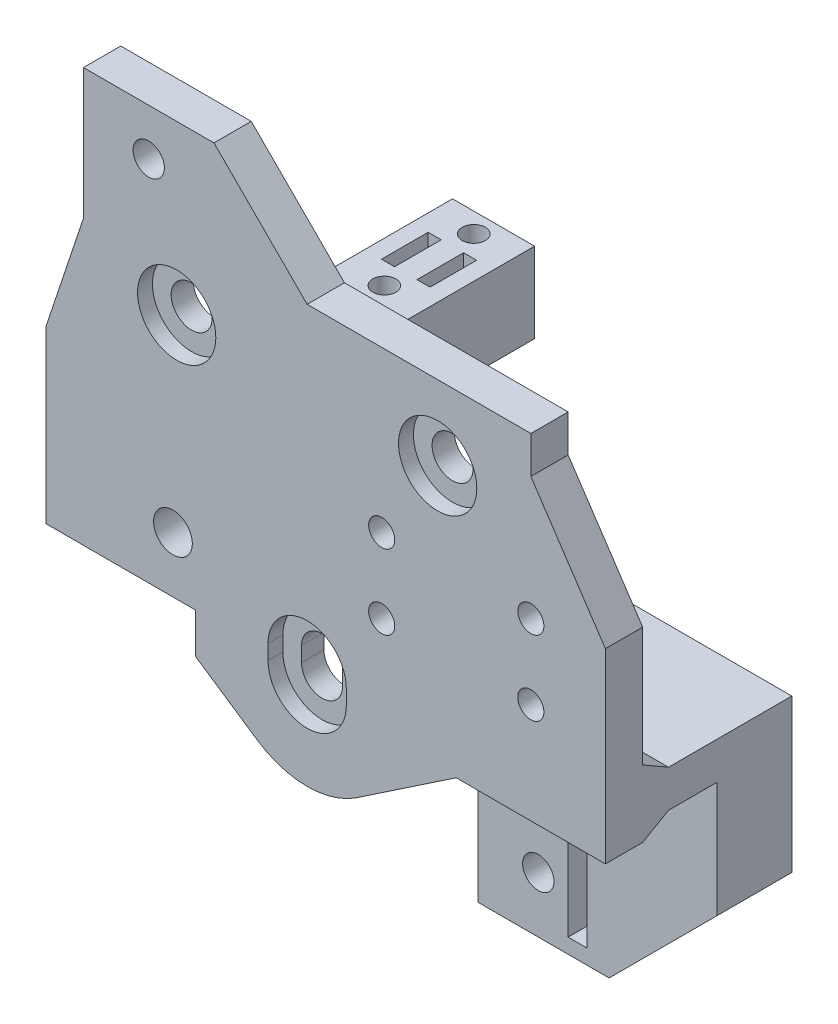
from build123d import *

# Parameters (mm, degrees)
SKETCH_1_R          = 2.75
SKETCH_1_R_2        = 2.1
EXTRUDE_1_DEPTH     = 5
EXTRUDE_START       = 20
SKETCH_2_W          = 11
SKETCH_2_H          = 10.75
EXTRUDE_2_DEPTH     = 20
CHAMFER_1_SIZE      = 2
CHAMFER_1_SIZE2     = 3.464101615
CUT_EXTRUDE_START   = -2
SKETCH_8_R          = 5.25
SKETCH_8_R_2        = 2.75
CUT_EXTRUDE_3_DEPTH = 2
CUT_EXTRUDE_4_REACH = 73.666
SKETCH_9_W          = 1.75
SKETCH_9_H          = 6.25
SKETCH_10_R         = 1.55
CUT_EXTRUDE_5_DEPTH = 8
FILLET_1_R          = 1
CHAMFER_2_SIZE      = 3
SKETCH_11_R         = 1.6
CUT_EXTRUDE_6_DEPTH = 6
EXTRUDE_3_DEPTH     = 3
CHAMFER_3_SIZE      = 2
CHAMFER_4_SIZE      = 0.5
CHAMFER_5_SIZE      = 0.5
EXTRUDE_START_2     = -10
SKETCH_14_W         = 2.5
SKETCH_14_H         = 11
SKETCH_14_R         = 2.1
EXTRUDE_4_DEPTH     = 3
CHAMFER_6_SIZE      = 15
SKETCH_16_R         = 2.6
CUT_EXTRUDE_8_DEPTH = 8.4641
SKETCH_17_R         = 1.75
CUT_EXTRUDE_9_DEPTH = 68.455540914
CHAMFER_7_SIZE      = 2
SKETCH_18_W         = 7
SKETCH_18_H         = 15
EXTRUDE_5_DEPTH     = 2
CHAMFER_9_SIZE      = 2.5
CHAMFER_10_SIZE     = 15


# Some blends are built 0.0001 mm under size
with BuildPart() as part:
    # Эскиз1 → Бобышка-Вытянуть1 (new body)
    with BuildSketch(Plane.XY):
        with BuildLine():
            ThreePointArc((-6.702307645, -31.453847107), (0, -33.5), (6.702307645, -31.453847107))
            Line((6.702307645, -31.453847107), (20, -22.5))
            Line((20, -22.5), (40, -22.5))
            Line((40, -22.5), (40, 2.5))
            Line((40, 2.5), (30, 17.5))
            Line((30, 17.5), (30, 22.5))
            Line((30, 22.5), (0, 22.5))
            Line((0, 22.5), (-12.5, 35))
            Line((-12.5, 35), (-30, 35))
            Line((-30, 35), (-30, 17.5))
            Line((-30, 17.5), (-35, 2.5))
            Line((-35, 2.5), (-35, -20.5))
            Line((-35, -20.5), (-15, -20.5))
            Line((-15, -20.5), (-15, -25.86669208))
            Line((-15, -25.86669208), (-6.702307645, -31.453847107))
        make_face()
        with BuildLine():
            Line((-2.75, -21.5), (-2.75, -19.5))
            ThreePointArc((-2.75, -19.5), (0, -16.75), (2.75, -19.5))
            Line((2.75, -19.5), (2.75, -21.5))
            ThreePointArc((2.75, -21.5), (0, -24.25), (-2.75, -21.5))
        make_face(mode=Mode.SUBTRACT)
        with Locations((-17.5, 12.5)):
            Circle(SKETCH_1_R, mode=Mode.SUBTRACT)
        with Locations((-21.25, 28.75)):
            Circle(SKETCH_1_R_2, mode=Mode.SUBTRACT)
        with Locations((17.5, 12.5)):
            Circle(SKETCH_1_R, mode=Mode.SUBTRACT)
    extrude(amount=EXTRUDE_1_DEPTH)

    # Эскиз2 → Бобышка-Вытянуть2 (add)
    with BuildSketch(Plane(origin=(0, 0, 0), x_dir=(-1, 0, 0), z_dir=(0, 0, -1)).offset(EXTRUDE_START)):
        with Locations((0, 14.125)):
            Rectangle(SKETCH_2_W, SKETCH_2_H)
        with BuildLine():
            Line((35, -15.5), (10.392304845, -15.5))
            ThreePointArc((10.392304845, -15.5), (11.451504073, -17.913489932), (11.958260743, -20.5))
            Line((11.958260743, -20.5), (15, -20.5))
            Line((15, -20.5), (35, -20.5))
            Line((35, -20.5), (35, -15.5))
        make_face()
        with BuildLine():
            ThreePointArc((11.958260743, -20.5), (11.451504073, -17.913489932), (10.392304845, -15.5))
            Line((10.392304845, -15.5), (10.392304845, -20.5))
            Line((10.392304845, -20.5), (11.958260743, -20.5))
        make_face()
        with BuildLine():
            Line((-10.392304845, -20.5), (-10.392304845, -15.5))
            ThreePointArc((-10.392304845, -15.5), (-11.451504073, -17.913489932), (-11.958260743, -20.5))
            Line((-11.958260743, -20.5), (-10.392304845, -20.5))
        make_face()
        with BuildLine():
            Line((-10.392304845, -15.5), (-40, -15.5))
            Line((-40, -15.5), (-40, -20.5))
            Line((-40, -20.5), (-11.958260743, -20.5))
            ThreePointArc((-11.958260743, -20.5), (-11.451504073, -17.913489932), (-10.392304845, -15.5))
        make_face()
    extrude(amount=-EXTRUDE_2_DEPTH)

    # Фаска1
    chamfer_1_edges = [part.edges().sort_by_distance(p)[0] for p in [
        (10.392304845, -18, 0),
        (25.196152423, -20.5, 0),
        (25.196152423, -15.5, 0),
        (-12.696152423, -20.5, 0),
        (-22.696152423, -15.5, 0),
        (-10.392304845, -18, 0),
    ]]
    chamfer_1_side = [part.faces().sort_by_distance(p)[0] for p in [
        (0.373325122, 0.80452147, 0),
    ]]
    chamfer(chamfer_1_edges, length=CHAMFER_1_SIZE, length2=CHAMFER_1_SIZE2, reference=chamfer_1_side[0])

    # Эскиз8 → Вырез-Вытянуть3 (cut)
    # profile 1 of 3: a face of its own
    with BuildSketch(Plane.XY.offset(5).offset(CUT_EXTRUDE_START)):
        with BuildLine():
            ThreePointArc((-5.25, -21.5), (0, -26.75), (5.25, -21.5))
            Line((5.25, -21.5), (5.25, -19.5))
            ThreePointArc((5.25, -19.5), (0, -14.25), (-5.25, -19.5))
            Line((-5.25, -19.5), (-5.25, -21.5))
        make_face()
        with BuildLine():
            Line((2.75, -19.5), (2.75, -21.5))
            ThreePointArc((2.75, -21.5), (0, -24.25), (-2.75, -21.5))
            Line((-2.75, -21.5), (-2.75, -19.5))
            ThreePointArc((-2.75, -19.5), (0, -16.75), (2.75, -19.5))
        make_face(mode=Mode.SUBTRACT)
    # profile 2 of 3: a face of its own
    with BuildSketch(Plane.XY.offset(5).offset(CUT_EXTRUDE_START)):
        with Locations((-17.5, 12.5)):
            Circle(SKETCH_8_R)
        with Locations((-17.5, 12.5)):
            Circle(SKETCH_8_R_2, mode=Mode.SUBTRACT)
    # profile 3 of 3: a face of its own
    with BuildSketch(Plane.XY.offset(5).offset(CUT_EXTRUDE_START)):
        with Locations((17.5, 12.5)):
            Circle(SKETCH_8_R)
        with Locations((17.5, 12.5)):
            Circle(SKETCH_8_R_2, mode=Mode.SUBTRACT)
    extrude(amount=CUT_EXTRUDE_3_DEPTH, mode=Mode.SUBTRACT)

    # Эскиз9 → Вырез-Вытянуть4 (cut, up to next)
    with BuildSketch(Plane(origin=(0, 22.5, 0), x_dir=(1, 0, 0), z_dir=(0, 1, 0)), mode=Mode.PRIVATE) as cut_extrude_4_sk1:
        with Locations((-2.375, 11.35)):
            Rectangle(SKETCH_9_W, SKETCH_9_H)
    cut_extrude_4_tool1 = extrude(cut_extrude_4_sk1.sketch, amount=-CUT_EXTRUDE_4_REACH, mode=Mode.PRIVATE) & part.part
    # Эскиз9 → Вырез-Вытянуть4 (cut, up to next)
    with BuildSketch(Plane(origin=(0, 22.5, 0), x_dir=(1, 0, 0), z_dir=(0, 1, 0)), mode=Mode.PRIVATE) as cut_extrude_4_sk2:
        with Locations((2.375, 11.35)):
            Rectangle(SKETCH_9_W, SKETCH_9_H)
    cut_extrude_4_tool2 = extrude(cut_extrude_4_sk2.sketch, amount=-CUT_EXTRUDE_4_REACH, mode=Mode.PRIVATE) & part.part
    add(cut_extrude_4_tool1.solids().sort_by_distance((-2.375, 22.5, -11.35))[0], mode=Mode.SUBTRACT)
    add(cut_extrude_4_tool2.solids().sort_by_distance((2.375, 22.5, -11.35))[0], mode=Mode.SUBTRACT)

    # Эскиз10 → Вырез-Вытянуть5 (cut)
    with BuildSketch(Plane(origin=(0, 22.5, 0), x_dir=(1, 0, 0), z_dir=(0, 1, 0))):
        with Locations(Location((0, 17.35, 0), (0, 0, 270))):
            Circle(SKETCH_10_R)
        with Locations(Location((0, 5.35, 0), (0, 0, 270))):
            Circle(SKETCH_10_R)
    extrude(amount=-CUT_EXTRUDE_5_DEPTH, mode=Mode.SUBTRACT)

    # Скругление1
    fillet_1_edges = [part.edges().sort_by_distance(p)[0] for p in [
        (-3.25, 8.75, -11.35),
        (-1.5, 8.75, -11.35),
        (3.25, 8.75, -11.35),
        (1.5, 8.75, -11.35),
    ]]
    fillet(fillet_1_edges, radius=FILLET_1_R)

    # Фаска2
    chamfer_2_edges = [part.edges().sort_by_distance(p)[0] for p in [
        (5.5, 14.125, 0),
        (-5.5, 14.125, 0),
        (0, 19.5, 0),
    ]]
    chamfer(chamfer_2_edges, length=CHAMFER_2_SIZE - 0.0001)  # a hair under: the kernel refuses the full size

    # Эскиз11 → Вырез-Вытянуть6 (cut)
    with BuildSketch(Plane.XZ.offset(20.5)):
        with Locations(Location((-27.5, -15, 0), (0, 0, 270))):
            Circle(SKETCH_11_R)
        with Locations(Location((-27.5, 0, 0), (0, 0, 270))):
            Circle(SKETCH_11_R)
    extrude(amount=-CUT_EXTRUDE_6_DEPTH, mode=Mode.SUBTRACT)

    # Эскиз12 → Бобышка-Вытянуть3 (add)
    with BuildSketch(Plane(origin=(0, 0, -20), x_dir=(-1, 0, 0), z_dir=(0, 0, -1))):
        Polygon((23.75, -25.545), (23.75, -20.5), (21.75, -20.5), (21.75, -27.545), (33.25, -27.545), (33.25, -20.5), (31.25, -20.5), (31.25, -25.545), align=None)
    extrude(amount=-EXTRUDE_3_DEPTH)

    # Фаска3
    # the kernel refuses this chamfer: 2 mm, written as the material it adds along each edge
    with BuildSketch(Plane(origin=(-33.25, -20.5, -20), x_dir=(-0.9996219169112968, 0.027495876610585647, 0), z_dir=(0, 0, 1))) as chamfer_3_piece_1_section:
        Polygon((CHAMFER_3_SIZE * 0.999621916911, CHAMFER_3_SIZE * 0.0274958766106), (-CHAMFER_3_SIZE * 0.0274958766106, CHAMFER_3_SIZE * 0.999621916911), (0, 0), align=None)
    chamfer_3_piece_1 = extrude(amount=3, mode=Mode.PRIVATE)
    chamfer_3_piece_1 = split(chamfer_3_piece_1, bisect_by=Plane(origin=(-35, -21.175979667, -18.5), z_dir=(1, 0, 0)), keep=Keep.TOP, mode=Mode.PRIVATE)
    add(chamfer_3_piece_1)
    with BuildSketch(Plane(origin=(-21.75, -20.5, -20), x_dir=(0.9996219169112968, 0.027495876610585647, 0), z_dir=(0, 0, 1))) as chamfer_3_piece_2:
        Polygon((CHAMFER_3_SIZE * 0.999621916911, -CHAMFER_3_SIZE * 0.0274958766106), (-CHAMFER_3_SIZE * 0.0274958766106, -CHAMFER_3_SIZE * 0.999621916911), (0, 0), align=None)
    extrude(amount=3)

    # Фаска4
    chamfer_4_edges = [part.edges().sort_by_distance(p)[0] for p in [
        (-23.75, -20.5, -18.5),
        (-31.25, -20.5, -18.5),
    ]]
    chamfer(chamfer_4_edges, length=CHAMFER_4_SIZE)

    # Фаска5
    chamfer_5_edges = [part.edges().sort_by_distance(p)[0] for p in [
        (-23.75, -25.545, -18.5),
        (-31.25, -25.545, -18.5),
    ]]
    chamfer(chamfer_5_edges, length=CHAMFER_5_SIZE)

    # Эскиз14 → Бобышка-Вытянуть4 (add)
    with BuildSketch(Plane(origin=(0, 0, -20), x_dir=(-1, 0, 0), z_dir=(0, 0, -1)).offset(EXTRUDE_START_2)):
        Polygon((-40, -20.5), (-40, -35.5), (-25.5, -35.5), (-25.5, -50.5), (-7.892304845, -50.5), (-7.892304845, -35.5), (-10.392304845, -35.5), (-10.392304845, -20.5), align=None)
        with Locations((-21.25, -43)):
            Rectangle(SKETCH_14_W, SKETCH_14_H, mode=Mode.SUBTRACT)
        with Locations((-16, -43)):
            Circle(SKETCH_14_R, mode=Mode.SUBTRACT)
    extrude(amount=EXTRUDE_4_DEPTH)

    # Фаска6
    # the kernel refuses this chamfer: 15 mm, written as the material it adds along each edge
    with BuildSketch(Plane(origin=(10.392304845, -20.5, -13), x_dir=(0, 0.027495876610586303, -0.9996219169112966), z_dir=(1, 0, 0))) as chamfer_6_piece_1_section:
        Polygon((CHAMFER_6_SIZE * 0.999621916911, -CHAMFER_6_SIZE * 0.0274958766106), (-CHAMFER_6_SIZE * 0.0274958766106, -CHAMFER_6_SIZE * 0.999621916911), (0, 0), align=None)
    chamfer_6_piece_1 = extrude(amount=29.607695155, mode=Mode.PRIVATE)
    chamfer_6_piece_1 = split(chamfer_6_piece_1, bisect_by=Plane(origin=(17.946152423, -26.478099439, -20), z_dir=(0, 0, 1)), keep=Keep.TOP, mode=Mode.PRIVATE)
    chamfer_6_piece_1 = split(chamfer_6_piece_1, bisect_by=Plane(origin=(25.5, -26.478099439, -15.943264036), z_dir=(-1, 0, 0)), keep=Keep.TOP, mode=Mode.PRIVATE)
    chamfer_6_piece_1 = split(chamfer_6_piece_1, bisect_by=Plane(origin=(17.946152423, -35.5, -15.943264036), z_dir=(0, 1, 0)), keep=Keep.TOP, mode=Mode.PRIVATE)
    add(chamfer_6_piece_1)
    with BuildSketch(Plane(origin=(10.392304845, -20.5, -13), x_dir=(0, 0.027495876610586303, -0.9996219169112966), z_dir=(1, 0, 0))) as chamfer_6_piece_2_section:
        Polygon((CHAMFER_6_SIZE * 0.999621916911, -CHAMFER_6_SIZE * 0.0274958766106), (-CHAMFER_6_SIZE * 0.0274958766106, -CHAMFER_6_SIZE * 0.999621916911), (0, 0), align=None)
    chamfer_6_piece_2 = extrude(amount=29.607695155, mode=Mode.PRIVATE)
    chamfer_6_piece_2 = split(chamfer_6_piece_2, bisect_by=Plane(origin=(32.75, -26.478099439, -20), z_dir=(0, 0, 1)), keep=Keep.TOP, mode=Mode.PRIVATE)
    chamfer_6_piece_2 = split(chamfer_6_piece_2, bisect_by=Plane(origin=(25.5, -26.478099439, -15.943264036), z_dir=(1, 0, 0)), keep=Keep.TOP, mode=Mode.PRIVATE)
    chamfer_6_piece_2 = split(chamfer_6_piece_2, bisect_by=Plane(origin=(32.75, -35.5, -15.943264036), z_dir=(0, 1, 0)), keep=Keep.TOP, mode=Mode.PRIVATE)
    add(chamfer_6_piece_2)

    # Эскиз16 → Вырез-Вытянуть8 (cut)
    with BuildSketch(Plane.XY.offset(5)):
        with Locations((-18, -13)):
            Circle(SKETCH_16_R)
    extrude(amount=-CUT_EXTRUDE_8_DEPTH, mode=Mode.SUBTRACT)

    # Эскиз17 → Вырез-Вытянуть9 (cut, through all)
    with BuildSketch(Plane(origin=(0, 0, 0), x_dir=(-1, 0, 0), z_dir=(0, 0, -1))):
        with Locations((-30, 1)):
            Circle(SKETCH_17_R)
        with Locations((-10, 1)):
            Circle(SKETCH_17_R)
        with Locations((-10, -9)):
            Circle(SKETCH_17_R)
        with Locations((-30, -9)):
            Circle(SKETCH_17_R)
    extrude(amount=-CUT_EXTRUDE_9_DEPTH, mode=Mode.SUBTRACT)

    # Фаска7
    chamfer_7_edges = [part.edges().sort_by_distance(p)[0] for p in [
        (31.75, -9, 0),
        (11.75, -9, 0),
        (11.75, 1, 0),
        (31.75, 1, 0),
    ]]
    chamfer(chamfer_7_edges, length=CHAMFER_7_SIZE)

    # Эскиз18 → Бобышка-Вытянуть5 (add)
    with BuildSketch(Plane(origin=(40, 0, 0), x_dir=(0, 0, -1), z_dir=(1, 0, 0))):
        with Locations((16.5, -28)):
            Rectangle(SKETCH_18_W, SKETCH_18_H)
    extrude(amount=-EXTRUDE_5_DEPTH)

    # Фаска9
    chamfer_9_edges = [part.edges().sort_by_distance(p)[0] for p in [
        (10.392304845, -35.5, -11.5),
    ]]
    chamfer(chamfer_9_edges, length=CHAMFER_9_SIZE - 0.0001)  # a hair under: the kernel refuses the full size

    # Фаска10
    # the kernel refuses this chamfer: 15 mm, written as the material it adds along each edge
    with BuildSketch(Plane(origin=(25.5, -35.5, -10), x_dir=(0.9996219169112968, 0.02749587661058632, 0), z_dir=(0, 0, -1))) as chamfer_10_piece_1_section:
        Polygon((CHAMFER_10_SIZE * 0.999621916911, CHAMFER_10_SIZE * 0.0274958766106), (-CHAMFER_10_SIZE * 0.0274958766106, CHAMFER_10_SIZE * 0.999621916911), (0, 0), align=None)
    chamfer_10_piece_1 = extrude(amount=3, mode=Mode.PRIVATE)
    chamfer_10_piece_1 = split(chamfer_10_piece_1, bisect_by=Plane(origin=(40, -36.201298701, -11.149350649), z_dir=(-1, 0, 0)), keep=Keep.TOP, mode=Mode.PRIVATE)
    add(chamfer_10_piece_1)
    with BuildSketch(Plane(origin=(25.5, -35.5, 28.575244819), x_dir=(0.9996219169112968, 0.02749587661058632, 0), z_dir=(0, 0, -1))) as chamfer_10_piece_2_section:
        Polygon((CHAMFER_10_SIZE * 0.999621916911, CHAMFER_10_SIZE * 0.0274958766106), (-CHAMFER_10_SIZE * 0.0274958766106, CHAMFER_10_SIZE * 0.999621916911), (0, 0), align=None)
    chamfer_10_piece_2 = extrude(amount=80.150489639, mode=Mode.PRIVATE)
    chamfer_10_piece_2 = split(chamfer_10_piece_2, bisect_by=Plane(origin=(38.777777778, -34.180555556, -14.319444444), z_dir=(0, -0.7071067811862648, -0.7071067811868302)), keep=Keep.TOP, mode=Mode.PRIVATE)
    chamfer_10_piece_2 = split(chamfer_10_piece_2, bisect_by=Plane(origin=(38, -36.361111111, -16.5), z_dir=(1, 0, 0)), keep=Keep.TOP, mode=Mode.PRIVATE)
    chamfer_10_piece_2 = split(chamfer_10_piece_2, bisect_by=Plane(origin=(38.777777778, -36.361111111, -20), z_dir=(0, 0, 1)), keep=Keep.TOP, mode=Mode.PRIVATE)
    chamfer_10_piece_2 = split(chamfer_10_piece_2, bisect_by=Plane(origin=(40, -36.361111111, -16.5), z_dir=(-1, 0, 0)), keep=Keep.TOP, mode=Mode.PRIVATE)
    add(chamfer_10_piece_2)


solid = part.part
